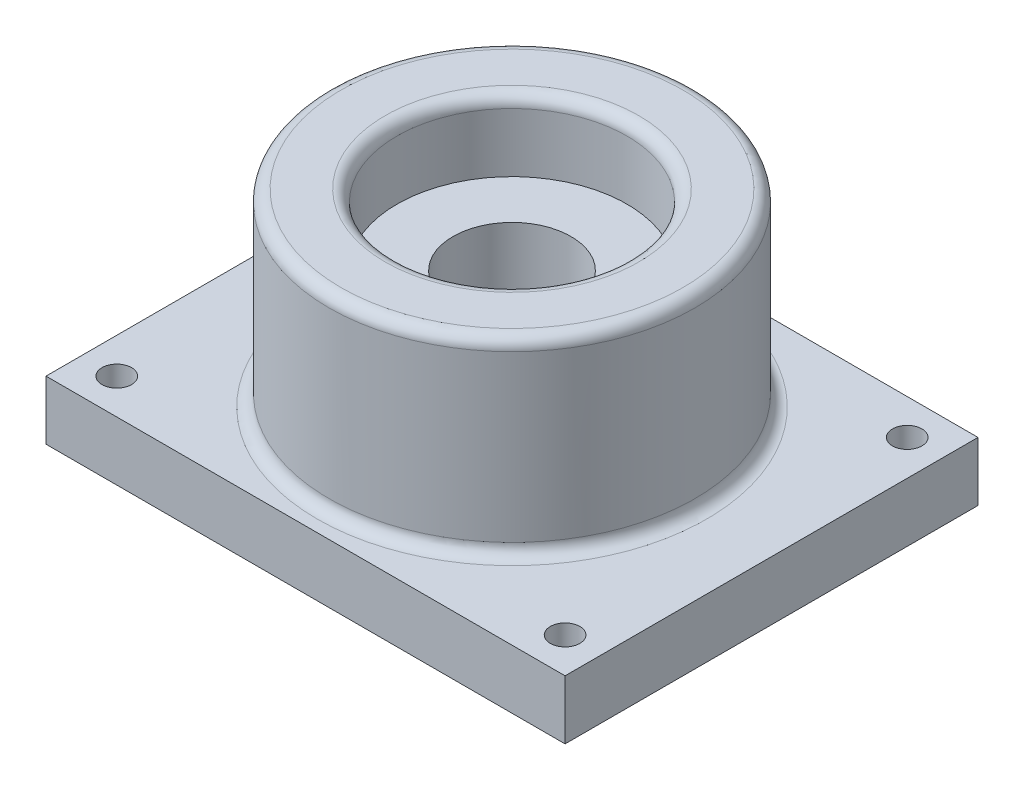
from build123d import *

# Parameters (mm, degrees)
SKETCH1_R           = 15.5
BOSS_EXTRUDE1_DEPTH = 16
SKETCH16_W          = 44
SKETCH16_H          = 35
SKETCH16_R          = 1.25
BOSS_EXTRUDE6_DEPTH = 5
SKETCH17_R          = 9.75
CUT_EXTRUDE5_DEPTH  = 6
SKETCH18_R          = 5
CUT_EXTRUDE7_DEPTH  = 19
FILLET4_R           = 1
FILLET1_R           = 1
FILLET3_R           = 1


with BuildPart() as part:
    # Sketch1 → Boss-Extrude1 (new body)
    with BuildSketch(Plane(origin=(0, 0, 0), x_dir=(1, 0, 0), z_dir=(0, 1, 0))):
        Circle(SKETCH1_R)
    extrude(amount=BOSS_EXTRUDE1_DEPTH)

    # Sketch16 → Boss-Extrude6 (add)
    with BuildSketch(Plane.XZ):
        Rectangle(SKETCH16_W, SKETCH16_H)
        with Locations((-19, 14.5)):
            Circle(SKETCH16_R, mode=Mode.SUBTRACT)
        with Locations((19, 14.5)):
            Circle(SKETCH16_R, mode=Mode.SUBTRACT)
        with Locations((19, -14.5)):
            Circle(SKETCH16_R, mode=Mode.SUBTRACT)
        with Locations((-19, -14.5)):
            Circle(SKETCH16_R, mode=Mode.SUBTRACT)
    extrude(amount=BOSS_EXTRUDE6_DEPTH)

    # Sketch17 → Cut-Extrude5 (cut)
    with BuildSketch(Plane(origin=(0, 16, 0), x_dir=(1, 0, 0), z_dir=(0, 1, 0))):
        Circle(SKETCH17_R)
    extrude(amount=-CUT_EXTRUDE5_DEPTH, mode=Mode.SUBTRACT)

    # Sketch18 → Cut-Extrude7 (cut)
    with BuildSketch(Plane(origin=(0, 10, 0), x_dir=(1, 0, 0), z_dir=(0, 1, 0))):
        Circle(SKETCH18_R)
    extrude(amount=-CUT_EXTRUDE7_DEPTH, mode=Mode.SUBTRACT)

    # Fillet4
    fillet4_edges = [part.edges().sort_by_distance(p)[0] for p in [
        (-15.5, 0, 0),
    ]]
    fillet(fillet4_edges, radius=FILLET4_R)

    # Fillet1
    fillet1_edges = [part.edges().sort_by_distance(p)[0] for p in [
        (-9.75, 16, 0),
    ]]
    fillet(fillet1_edges, radius=FILLET1_R)

    # Fillet3
    fillet3_edges = [part.edges().sort_by_distance(p)[0] for p in [
        (-15.5, 16, 0),
    ]]
    fillet(fillet3_edges, radius=FILLET3_R)


solid = part.part
